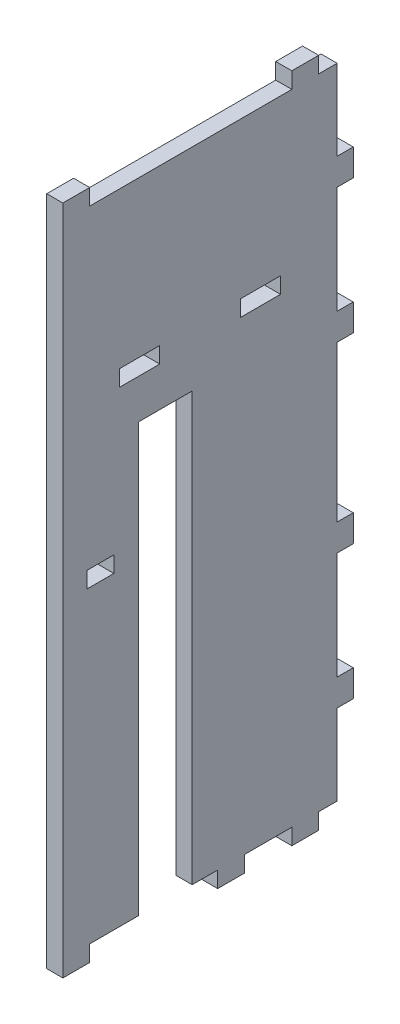
from build123d import *

# Parameters (mm, degrees)
ESQUISSE1_W             = 102.17
ESQUISSE1_H             = 238
ESQUISSE1_W_2           = 10
ESQUISSE1_H_2           = 6
ESQUISSE1_W_3           = 15
BOSS_EXTRU_1_DEPTH      = 6
ESQUISSE3_W             = 10
ESQUISSE3_H             = 6
ESQUISSE3_W_2           = 6
ESQUISSE3_H_2           = 10
BOSS_EXTRU_5_DEPTH      = 6
ESQUISSE6_W             = 20
ESQUISSE6_H             = 159.29
ENL_V_MAT_EXTRU_2_DEPTH = 6


with BuildPart() as part:
    # Esquisse1 → Boss.-Extru.1 (new body)
    with BuildSketch(Plane(origin=(0, 0, 0), x_dir=(0, 0, -1), z_dir=(1, 0, 0))):
        Rectangle(ESQUISSE1_W, ESQUISSE1_H)
        with Locations((-37.085, -1)):
            Rectangle(ESQUISSE1_W_2, ESQUISSE1_H_2, mode=Mode.SUBTRACT)
        with Locations((-22.5, 58)):
            Rectangle(ESQUISSE1_W_3, ESQUISSE1_H_2, mode=Mode.SUBTRACT)
        with Locations((22.5, 58)):
            Rectangle(ESQUISSE1_W_3, ESQUISSE1_H_2, mode=Mode.SUBTRACT)
    extrude(amount=BOSS_EXTRU_1_DEPTH)

    # Esquisse3 → Boss.-Extru.5 (add)
    with BuildSketch(Plane(origin=(6, 0, 0), x_dir=(0, 0, -1), z_dir=(1, 0, 0))):
        with Locations((-46.085, -122)):
            Rectangle(ESQUISSE3_W, ESQUISSE3_H)
        with Locations((39.205, -122)):
            Rectangle(ESQUISSE3_W, ESQUISSE3_H)
        with Locations((54.085, 34)):
            Rectangle(ESQUISSE3_W_2, ESQUISSE3_H_2)
        with Locations((54.085, 84)):
            Rectangle(ESQUISSE3_W_2, ESQUISSE3_H_2)
        with Locations((54.085, -84)):
            Rectangle(ESQUISSE3_W_2, ESQUISSE3_H_2)
        with Locations((54.085, -34)):
            Rectangle(ESQUISSE3_W_2, ESQUISSE3_H_2)
        with Locations((11.585, -122)):
            Rectangle(ESQUISSE3_W, ESQUISSE3_H)
        with Locations((39.205, 122)):
            Rectangle(ESQUISSE3_W, ESQUISSE3_H)
        with Locations((-46.085, 122)):
            Rectangle(ESQUISSE3_W, ESQUISSE3_H)
    extrude(amount=-BOSS_EXTRU_5_DEPTH)

    # Esquisse6 → Enlèv. mat.-Extru.2 (cut)
    with BuildSketch(Plane(origin=(6, 0, 0), x_dir=(0, 0, -1), z_dir=(1, 0, 0))):
        with Locations((-12.915, -39.355)):
            Rectangle(ESQUISSE6_W, ESQUISSE6_H)
    extrude(amount=-ENL_V_MAT_EXTRU_2_DEPTH, mode=Mode.SUBTRACT)


solid = part.part
